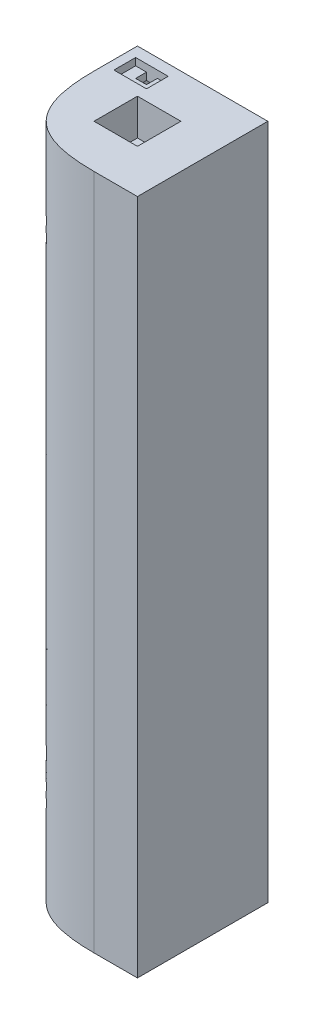
from build123d import *

# Parameters (mm, degrees)
SKETCH1_W           = 36
SKETCH1_H           = 36
BOSS_EXTRUDE1_DEPTH = 186.9
FILLET1_SIZE        = 24
SKETCH2_R           = 2
CUT_EXTRUDE1_DEPTH  = 5
SKETCH3_W           = 4.8
SKETCH3_H           = 4.8
BOSS_EXTRUDE2_DEPTH = 4
SKETCH4_W           = 6
SKETCH4_H           = 4
CUT_EXTRUDE2_DEPTH  = 9
SKETCH5_W           = 3
SKETCH5_H           = 3
SKETCH5_W_2         = 12
SKETCH5_H_2         = 12
CUT_EXTRUDE3_DEPTH  = 10
SKETCH6_W           = 9
SKETCH6_H           = 6
CUT_EXTRUDE4_DEPTH  = 2


with BuildPart() as part:
    # Sketch1 → Boss-Extrude1 (new body)
    with BuildSketch(Plane(origin=(0, 0, 0), x_dir=(1, 0, 0), z_dir=(0, 1, 0))):
        with Locations((18, 18)):
            Rectangle(SKETCH1_W, SKETCH1_H)
    extrude(amount=BOSS_EXTRUDE1_DEPTH)

    # Fillet1
    # a fillet whose section is not a circle: 24 mm, written as the material it takes off along each edge
    with BuildSketch(Plane(origin=(0, -60, 0), x_dir=(1, 0, 0), z_dir=(0, 1, 0))) as fillet1_piece_1:
        with BuildLine():
            Bezier((FILLET1_SIZE, 0), (0, 0), (0, FILLET1_SIZE), weights=[1, 1.222222222, 1])
            Line((0, FILLET1_SIZE), (0, 0))
            Line((0, 0), (FILLET1_SIZE, 0))
        make_face()
    extrude(amount=306.9, mode=Mode.SUBTRACT)

    # Sketch2 → Cut-Extrude1 (cut)
    with BuildSketch(Plane.XZ):
        with Locations(Location((18, -18, 0), (0, 0, 270))):
            Circle(SKETCH2_R)
    extrude(amount=-CUT_EXTRUDE1_DEPTH, mode=Mode.SUBTRACT)

    # Sketch3 → Boss-Extrude2 (add)
    with BuildSketch(Plane.XZ):
        Polygon((26.2, -5), (31, -5), (31, -31), (26, -31), (5, -31), (5, -26.2), (26.2, -26.2), align=None)
        with Locations((11.8, -11.8)):
            Rectangle(SKETCH3_W, SKETCH3_H)
    extrude(amount=BOSS_EXTRUDE2_DEPTH)

    # Sketch4 → Cut-Extrude2 (cut)
    with BuildSketch(Plane(origin=(0, 0, -36), x_dir=(-1, 0, 0), z_dir=(0, 0, -1))):
        with Locations((-7, 180.9)):
            Rectangle(SKETCH4_W, SKETCH4_H)
        with Locations((-29, 180.9)):
            Rectangle(SKETCH4_W, SKETCH4_H)
        with Locations((-7, 160.9)):
            Rectangle(SKETCH4_W, SKETCH4_H)
    extrude(amount=-CUT_EXTRUDE2_DEPTH, mode=Mode.SUBTRACT)

    # Sketch5 → Cut-Extrude3 (cut)
    with BuildSketch(Plane(origin=(0, 186.9, 0), x_dir=(1, 0, 0), z_dir=(0, 1, 0))):
        with Locations((7, 31.5)):
            Rectangle(SKETCH5_W, SKETCH5_H)
        with Locations((18, 18)):
            Rectangle(SKETCH5_W_2, SKETCH5_H_2)
    extrude(amount=-CUT_EXTRUDE3_DEPTH, mode=Mode.SUBTRACT)

    # Sketch6 → Cut-Extrude4 (cut)
    with BuildSketch(Plane(origin=(0, 186.9, 0), x_dir=(1, 0, 0), z_dir=(0, 1, 0))):
        with Locations((7, 30)):
            Rectangle(SKETCH6_W, SKETCH6_H)
    extrude(amount=-CUT_EXTRUDE4_DEPTH, mode=Mode.SUBTRACT)


solid = part.part
